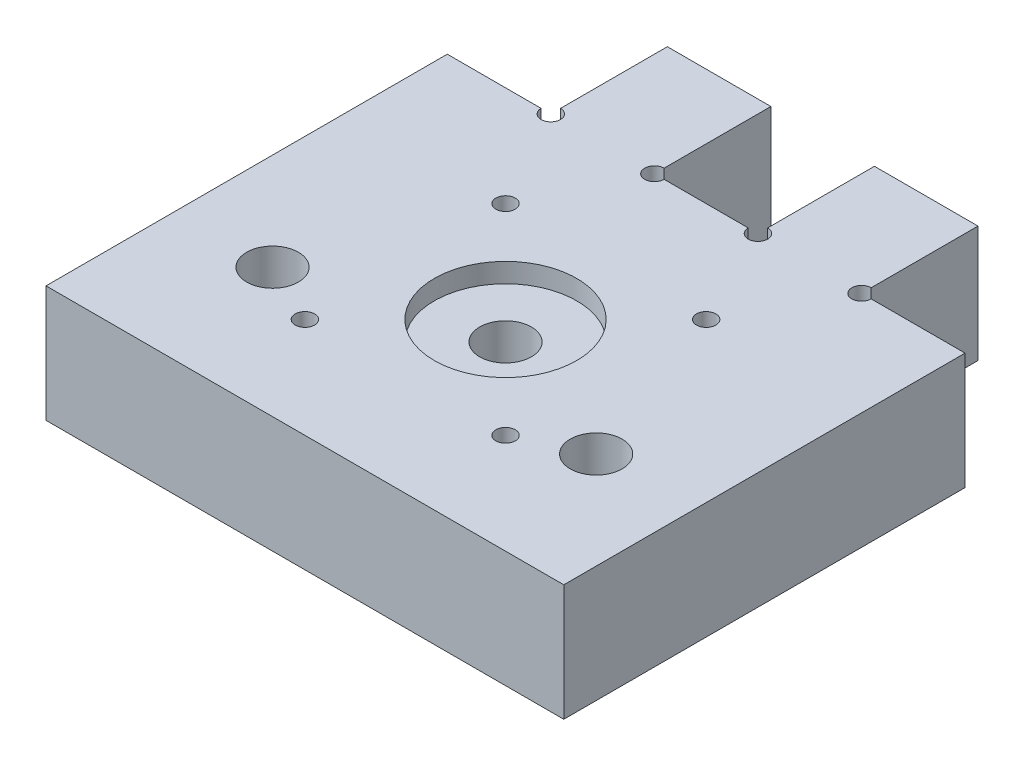
from build123d import *

# Parameters (mm, degrees)
SKETCH1_R           = 4
SKETCH1_R_2         = 1.5
BOSS_EXTRUDE1_DEPTH = 18
SKETCH2_R           = 11
CUT_EXTRUDE1_DEPTH  = 3
SKETCH3_R           = 1.5
CUT_EXTRUDE2_DEPTH  = 66.76473219


with BuildPart() as part:
    # Sketch1 → Boss-Extrude1 (new body)
    with BuildSketch(Plane(origin=(0, 0, 0), x_dir=(1, 0, 0), z_dir=(0, 1, 0))):
        Polygon((-40, 31), (-24, 31), (-24, 49), (-8, 49), (-8, 31), (8, 31), (8, 49), (24, 49), (24, 31), (40, 31), (40, -31), (-40, -31), align=None)
        Circle(SKETCH1_R, mode=Mode.SUBTRACT)
        with Locations((15.5, 15.5)):
            Circle(SKETCH1_R_2, mode=Mode.SUBTRACT)
        with Locations((-15.5, 15.5)):
            Circle(SKETCH1_R_2, mode=Mode.SUBTRACT)
        with Locations((-15.5, -15.5)):
            Circle(SKETCH1_R_2, mode=Mode.SUBTRACT)
        with Locations((15.5, -15.5)):
            Circle(SKETCH1_R_2, mode=Mode.SUBTRACT)
        with Locations((-25, -11)):
            Circle(SKETCH1_R, mode=Mode.SUBTRACT)
        with Locations((25, -11)):
            Circle(SKETCH1_R, mode=Mode.SUBTRACT)
    extrude(amount=BOSS_EXTRUDE1_DEPTH)

    # Sketch2 → Cut-Extrude1 (cut)
    with BuildSketch(Plane(origin=(0, 18, 0), x_dir=(1, 0, 0), z_dir=(0, 1, 0))):
        Circle(SKETCH2_R)
    extrude(amount=-CUT_EXTRUDE1_DEPTH, mode=Mode.SUBTRACT)

    # Sketch3 → Cut-Extrude2 (cut, through all)
    with BuildSketch(Plane(origin=(0, 18, 0), x_dir=(1, 0, 0), z_dir=(0, 1, 0))):
        with Locations((-24, 31)):
            Circle(SKETCH3_R)
        with Locations((-8, 31)):
            Circle(SKETCH3_R)
        with Locations((8, 31)):
            Circle(SKETCH3_R)
        with Locations((24, 31)):
            Circle(SKETCH3_R)
    extrude(amount=-CUT_EXTRUDE2_DEPTH, mode=Mode.SUBTRACT)


solid = part.part
